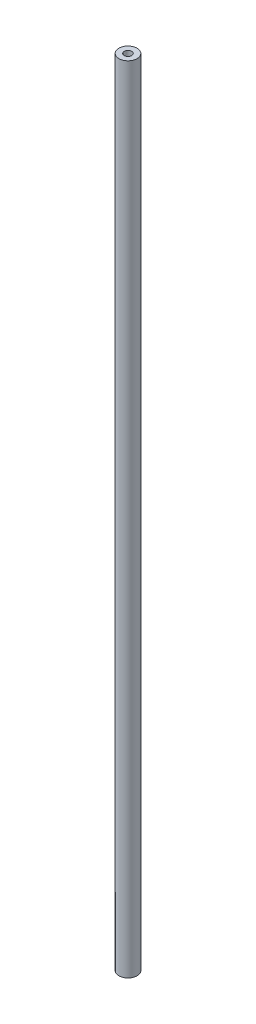
from build123d import *

# Parameters (mm, degrees)
SKETCH3_R             = 4
BOSS_EXTRUDE1_DEPTH   = 350
M4_TAPPED_HOLE1_D     = 3.3
M4_TAPPED_HOLE1_DEPTH = 2.4
M4_TAPPED_HOLE1_TIP   = 0.991420021
M4_TAPPED_HOLE2_D     = 3.3
M4_TAPPED_HOLE2_DEPTH = 2.4
M4_TAPPED_HOLE2_TIP   = 0.991420021


with BuildPart() as part:
    # Sketch3 → Boss-Extrude1 (new body)
    with BuildSketch(Plane(origin=(0, 0, 0), x_dir=(1, 0, 0), z_dir=(0, 1, 0))):
        Circle(SKETCH3_R)
    extrude(amount=BOSS_EXTRUDE1_DEPTH)

    # M4 Tapped Hole1
    with Locations(Plane(origin=(0, 350, 0), x_dir=(1, 0, 0), z_dir=(0, 1, 0))):
        with Locations((0, 0)):
            Hole(M4_TAPPED_HOLE1_D / 2, depth=M4_TAPPED_HOLE1_DEPTH)
            with Locations((0, 0, -(M4_TAPPED_HOLE1_DEPTH + M4_TAPPED_HOLE1_TIP / 2))):  # 118° drill point
                Cone(0, M4_TAPPED_HOLE1_D / 2, M4_TAPPED_HOLE1_TIP, mode=Mode.SUBTRACT)

    # M4 Tapped Hole2
    with Locations(Plane(origin=(0, 0, 0), x_dir=(-1, 0, 0), z_dir=(0, -1, 0))):
        with Locations((0, 0)):
            Hole(M4_TAPPED_HOLE2_D / 2, depth=M4_TAPPED_HOLE2_DEPTH)
            with Locations((0, 0, -(M4_TAPPED_HOLE2_DEPTH + M4_TAPPED_HOLE2_TIP / 2))):  # 118° drill point
                Cone(0, M4_TAPPED_HOLE2_D / 2, M4_TAPPED_HOLE2_TIP, mode=Mode.SUBTRACT)


solid = part.part
